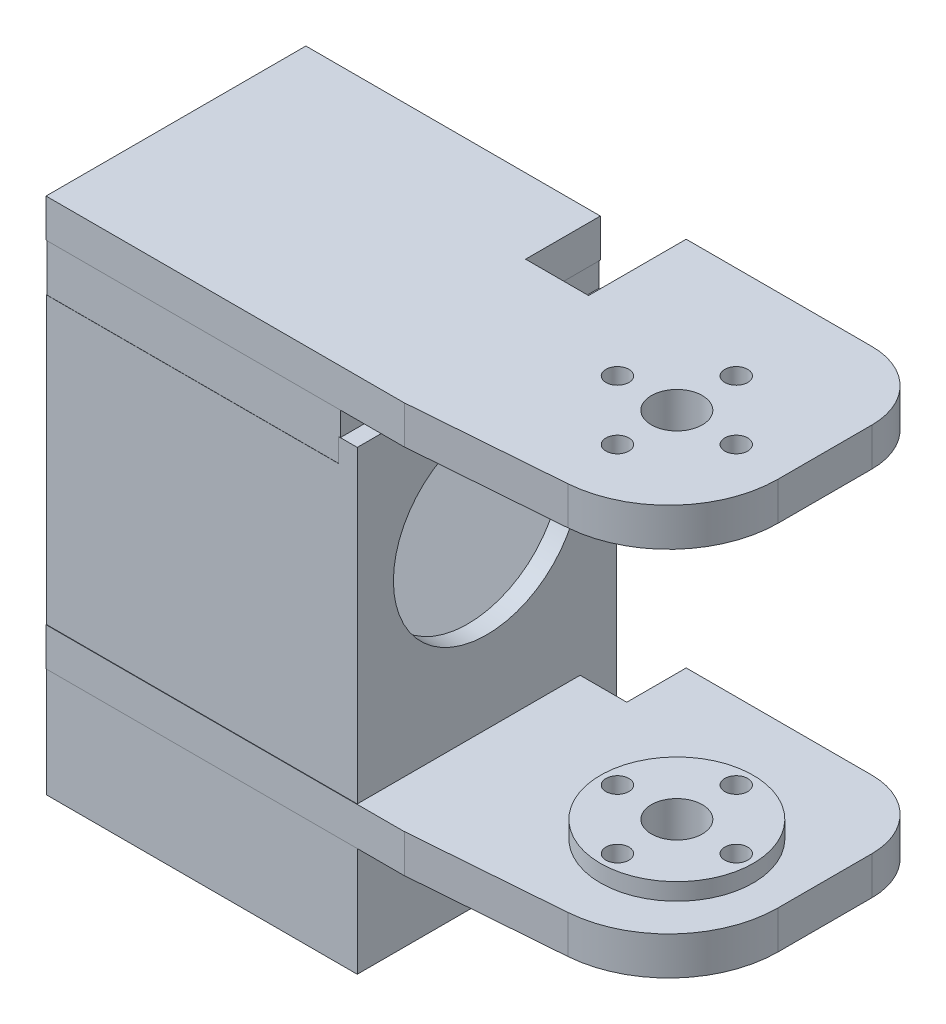
from build123d import *

# Parameters (mm, degrees)
BOSS_1_DEPTH  = 4.5
S_CYL2_R      = 9
BOSS_2_DEPTH  = 2
BOSS_3_DEPTH  = 4.5
S_PRISM4_W    = 7.775
S_PRISM4_H    = 21.81
BOSS_4_DEPTH  = 4.5
S_PRISM5_W    = 42.225
S_PRISM5_H    = 2.6
BOSS_5_DEPTH  = 4.5
S_PRISM6_W    = 34.7
S_PRISM6_H    = 30.62
BOSS_6_DEPTH  = 4.5
S_PRISM7_W    = 7.775
S_PRISM7_H    = 26.31
BOSS_7_DEPTH  = 4.5
S_PRISM8_W    = 42.225
S_PRISM8_H    = 2.6
BOSS_8_DEPTH  = 4.5
S_BOX9_W      = 34.4
S_BOX9_H      = 2.5
BOSS_9_DEPTH  = 30.52
S_BOX10_W     = 34.4
S_BOX10_H     = 51.02
BOSS_10_DEPTH = 2.5
S_BOX11_W     = 34.4
S_BOX11_H     = 51.02
BOSS_11_DEPTH = 2.5
S_BOX12_W     = 2.4
S_BOX12_H     = 51.02
BOSS_12_DEPTH = 30.52
S_BOX13_W     = 2.225
S_BOX13_H     = 53.77
BOSS_13_DEPTH = 30.52
S_BOX14_W     = 34.56
S_BOX14_H     = 5.825
BOSS_14_DEPTH = 30.48
S_HOLE15_R    = 3
HOLE_15_DEPTH = 4.7
S_HOLE16_R    = 1.35
HOLE_16_DEPTH = 4.7
S_HOLE17_R    = 1.35
HOLE_17_DEPTH = 4.7
S_HOLE18_R    = 1.35
HOLE_18_DEPTH = 4.7
S_HOLE19_R    = 1.35
HOLE_19_DEPTH = 4.7
S_HOLE20_R    = 3
HOLE_20_DEPTH = 6.7
S_HOLE21_R    = 1.35
HOLE_21_DEPTH = 6.7
S_HOLE22_R    = 1.35
HOLE_22_DEPTH = 6.7
S_HOLE23_R    = 1.35
HOLE_23_DEPTH = 6.7
S_HOLE24_R    = 1.35
HOLE_24_DEPTH = 6.7
S_HOLE25_R    = 11
HOLE_25_DEPTH = 2.6
S_HOLE26_R    = 1.1
HOLE_26_DEPTH = 2.6
S_HOLE27_R    = 1.1
HOLE_27_DEPTH = 2.6
S_HOLE28_R    = 1.1
HOLE_28_DEPTH = 2.6
S_HOLE29_R    = 11
HOLE_29_DEPTH = 2.425
CUT_30_DEPTH  = 34.6


with BuildPart() as part:
    # S_prism1 → Boss_1 (new body)
    with BuildSketch(Plane(origin=(0, 18.625, 0), x_dir=(1, 0, 0), z_dir=(0, 1, 0))):
        with BuildLine():
            Line((13, 10), (13, -1.0582))
            ThreePointArc((13, -1.0582), (9.566483076, -9.821518282), (1.0937, -13.9199))
            Line((1.0937, -13.9199), (-16.9, -15.31))
            Line((-16.9, -15.31), (-16.9, 18))
            Line((-16.9, 18), (5, 18))
            ThreePointArc((5, 18), (10.6569, 15.6569), (13, 10))
        make_face()
    extrude(amount=BOSS_1_DEPTH)

    # S_prism4 → Boss_4 (add)
    with BuildSketch(Plane(origin=(0, 18.625, 0), x_dir=(1, 0, 0), z_dir=(0, 1, 0))):
        with Locations((-20.6875, -4.405)):
            Rectangle(S_PRISM4_W, S_PRISM4_H)
    extrude(amount=BOSS_4_DEPTH)

    # S_prism5 → Boss_5 (add)
    with BuildSketch(Plane(origin=(0, 18.625, 0), x_dir=(1, 0, 0), z_dir=(0, 1, 0))):
        with Locations((-37.9125, -14.01)):
            Rectangle(S_PRISM5_W, S_PRISM5_H)
    extrude(amount=BOSS_5_DEPTH)

    # S_prism6 → Boss_6 (add)
    with BuildSketch(Plane(origin=(0, 18.625, 0), x_dir=(1, 0, 0), z_dir=(0, 1, 0))):
        with Locations((-41.675, 0)):
            Rectangle(S_PRISM6_W, S_PRISM6_H)
    extrude(amount=BOSS_6_DEPTH)



with BuildPart() as body_2:
    # S_cyl2 → Boss_2 (new body)
    with BuildSketch(Plane(origin=(0, -20.625, 0), x_dir=(1, 0, 0), z_dir=(0, 1, 0))):
        Circle(S_CYL2_R)
    extrude(amount=BOSS_2_DEPTH)

    # S_prism3 → Boss_3 (add)
    with BuildSketch(Plane(origin=(0, -25.125, 0), x_dir=(1, 0, 0), z_dir=(0, 1, 0))):
        with BuildLine():
            Line((13, 10), (13, -1.0582))
            ThreePointArc((13, -1.0582), (9.566483076, -9.821518282), (1.0937, -13.9199))
            Line((1.0937, -13.9199), (-16.9, -15.31))
            Line((-16.9, -15.31), (-16.9, 18))
            Line((-16.9, 18), (5, 18))
            ThreePointArc((5, 18), (10.6569, 15.6569), (13, 10))
        make_face()
    extrude(amount=BOSS_3_DEPTH)

    # S_prism7 → Boss_7 (add)
    with BuildSketch(Plane(origin=(0, -25.125, 0), x_dir=(1, 0, 0), z_dir=(0, 1, 0))):
        with Locations((-20.6875, -2.155)):
            Rectangle(S_PRISM7_W, S_PRISM7_H)
    extrude(amount=BOSS_7_DEPTH)

    # S_prism8 → Boss_8 (add)
    with BuildSketch(Plane(origin=(0, -25.125, 0), x_dir=(1, 0, 0), z_dir=(0, 1, 0))):
        with Locations((-37.9125, -14.01)):
            Rectangle(S_PRISM8_W, S_PRISM8_H)
    extrude(amount=BOSS_8_DEPTH)



with BuildPart() as body_3:
    # S_box9 → Boss_9 (new body)
    with BuildSketch(Plane.XY.offset(-15.26)):
        with Locations((-41.825, 11.76)):
            Rectangle(S_BOX9_W, S_BOX9_H)
    extrude(amount=BOSS_9_DEPTH)

    # S_box10 → Boss_10 (add)
    with BuildSketch(Plane.XY.offset(-15.26)):
        with Locations((-41.825, -12.5)):
            Rectangle(S_BOX10_W, S_BOX10_H)
    extrude(amount=BOSS_10_DEPTH)


with BuildPart() as body_2_1:
    add(body_2.part)

    add(body_3.part)  # Boss_11 merges body 3
    # S_box11 → Boss_11 (add)
    with BuildSketch(Plane.XY.offset(12.76)):
        with Locations((-41.825, -12.5)):
            Rectangle(S_BOX11_W, S_BOX11_H)
    extrude(amount=BOSS_11_DEPTH)

    # S_box12 → Boss_12 (add)
    with BuildSketch(Plane.XY.offset(-15.26)):
        with Locations((-57.825, -12.5)):
            Rectangle(S_BOX12_W, S_BOX12_H)
    extrude(amount=BOSS_12_DEPTH)

    # S_box13 → Boss_13 (add)
    with BuildSketch(Plane.XY.offset(-15.26)):
        with Locations((-23.5125, -11.125)):
            Rectangle(S_BOX13_W, S_BOX13_H)
    extrude(amount=BOSS_13_DEPTH)


with BuildPart() as part_1:
    add(part.part)

    add(body_2_1.part)  # Boss_14 merges body 2
    # S_box14 → Boss_14 (add)
    with BuildSketch(Plane.XY.offset(-15.24)):
        with Locations((-41.675, 15.8125)):
            Rectangle(S_BOX14_W, S_BOX14_H)
    extrude(amount=BOSS_14_DEPTH)

    # S_hole15 → Hole_15 (cut)
    with BuildSketch(Plane(origin=(0, 18.525, 0), x_dir=(1, 0, 0), z_dir=(0, 1, 0))):
        Circle(S_HOLE15_R)
    extrude(amount=HOLE_15_DEPTH, mode=Mode.SUBTRACT)

    # S_hole16 → Hole_16 (cut)
    with BuildSketch(Plane(origin=(0, 18.525, 0), x_dir=(1, 0, 0), z_dir=(0, 1, 0))):
        with Locations((7, 0)):
            Circle(S_HOLE16_R)
    extrude(amount=HOLE_16_DEPTH, mode=Mode.SUBTRACT)

    # S_hole17 → Hole_17 (cut)
    with BuildSketch(Plane(origin=(0, 18.525, 0), x_dir=(1, 0, 0), z_dir=(0, 1, 0))):
        with Locations((0, -7)):
            Circle(S_HOLE17_R)
    extrude(amount=HOLE_17_DEPTH, mode=Mode.SUBTRACT)

    # S_hole18 → Hole_18 (cut)
    with BuildSketch(Plane(origin=(0, 18.525, 0), x_dir=(1, 0, 0), z_dir=(0, 1, 0))):
        with Locations((-7, 0)):
            Circle(S_HOLE18_R)
    extrude(amount=HOLE_18_DEPTH, mode=Mode.SUBTRACT)

    # S_hole19 → Hole_19 (cut)
    with BuildSketch(Plane(origin=(0, 18.525, 0), x_dir=(1, 0, 0), z_dir=(0, 1, 0))):
        with Locations((0, 7)):
            Circle(S_HOLE19_R)
    extrude(amount=HOLE_19_DEPTH, mode=Mode.SUBTRACT)

    # S_hole20 → Hole_20 (cut)
    with BuildSketch(Plane(origin=(0, -25.225, 0), x_dir=(1, 0, 0), z_dir=(0, 1, 0))):
        Circle(S_HOLE20_R)
    extrude(amount=HOLE_20_DEPTH, mode=Mode.SUBTRACT)

    # S_hole21 → Hole_21 (cut)
    with BuildSketch(Plane(origin=(0, -25.225, 0), x_dir=(1, 0, 0), z_dir=(0, 1, 0))):
        with Locations((7, 0)):
            Circle(S_HOLE21_R)
    extrude(amount=HOLE_21_DEPTH, mode=Mode.SUBTRACT)

    # S_hole22 → Hole_22 (cut)
    with BuildSketch(Plane(origin=(0, -25.225, 0), x_dir=(1, 0, 0), z_dir=(0, 1, 0))):
        with Locations((0, -7)):
            Circle(S_HOLE22_R)
    extrude(amount=HOLE_22_DEPTH, mode=Mode.SUBTRACT)

    # S_hole23 → Hole_23 (cut)
    with BuildSketch(Plane(origin=(0, -25.225, 0), x_dir=(1, 0, 0), z_dir=(0, 1, 0))):
        with Locations((-7, 0)):
            Circle(S_HOLE23_R)
    extrude(amount=HOLE_23_DEPTH, mode=Mode.SUBTRACT)

    # S_hole24 → Hole_24 (cut)
    with BuildSketch(Plane(origin=(0, -25.225, 0), x_dir=(1, 0, 0), z_dir=(0, 1, 0))):
        with Locations((0, 7)):
            Circle(S_HOLE24_R)
    extrude(amount=HOLE_24_DEPTH, mode=Mode.SUBTRACT)

    # S_hole25 → Hole_25 (cut)
    with BuildSketch(Plane(origin=(-59.125, 0, 0), x_dir=(0, 0, -1), z_dir=(1, 0, 0))):
        Circle(S_HOLE25_R)
    extrude(amount=HOLE_25_DEPTH, mode=Mode.SUBTRACT)

    # S_hole26 → Hole_26 (cut)
    with BuildSketch(Plane(origin=(-59.125, 0, 0), x_dir=(0, 0, -1), z_dir=(1, 0, 0))):
        with Locations((-10.25, -8.3)):
            Circle(S_HOLE26_R)
    extrude(amount=HOLE_26_DEPTH, mode=Mode.SUBTRACT)

    # S_hole27 → Hole_27 (cut)
    with BuildSketch(Plane(origin=(-59.125, 0, 0), x_dir=(0, 0, -1), z_dir=(1, 0, 0))):
        with Locations((10.25, -32.75)):
            Circle(S_HOLE27_R)
    extrude(amount=HOLE_27_DEPTH, mode=Mode.SUBTRACT)

    # S_hole28 → Hole_28 (cut)
    with BuildSketch(Plane(origin=(-59.125, 0, 0), x_dir=(0, 0, -1), z_dir=(1, 0, 0))):
        with Locations((-10.25, -32.75)):
            Circle(S_HOLE28_R)
    extrude(amount=HOLE_28_DEPTH, mode=Mode.SUBTRACT)

    # S_hole29 → Hole_29 (cut)
    with BuildSketch(Plane(origin=(-24.725, 0, 0), x_dir=(0, 0, -1), z_dir=(1, 0, 0))):
        Circle(S_HOLE29_R)
    extrude(amount=HOLE_29_DEPTH, mode=Mode.SUBTRACT)

    # S_pcut30 → Cut_30 (cut)
    with BuildSketch(Plane(origin=(-59.125, 0, 0), x_dir=(0, 0, -1), z_dir=(1, 0, 0))):
        Polygon((15.86, -38.61), (15.86, -28.41), (5.66, -38.61), align=None)
    extrude(amount=CUT_30_DEPTH, mode=Mode.SUBTRACT)


solid = part_1.part
